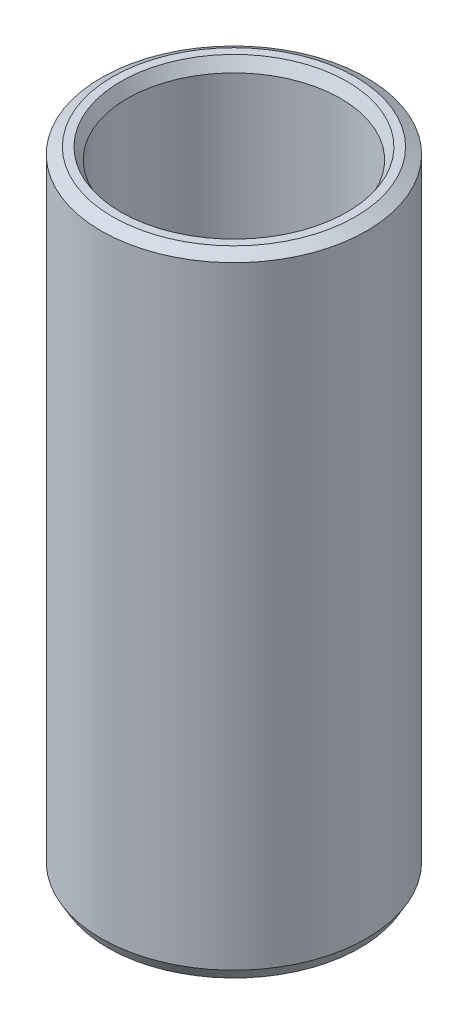
from build123d import *
from OCP.BRepFilletAPI import BRepFilletAPI_MakeChamfer

# Parameters (mm, degrees)
SKETCH1_R           = 55
BOSS_EXTRUDE1_DEPTH = 261.363555672
SKETCH2_R           = 44.170020311
CUT_EXTRUDE1_DEPTH  = 273.69196584
CHAMFER1_SIZE       = 2.720593937
CHAMFER1_SIZE2      = 4.712206925


with BuildPart() as part:
    # Sketch1 → Boss-Extrude1 (new body)
    with BuildSketch(Plane(origin=(0, 0, 0), x_dir=(1, 0, 0), z_dir=(0, 1, 0))):
        Circle(SKETCH1_R)
    extrude(amount=BOSS_EXTRUDE1_DEPTH)

    # Sketch2 → Cut-Extrude1 (cut, through all)
    with BuildSketch(Plane(origin=(0, 0, 0), x_dir=(1, 0, 0), z_dir=(0, 1, 0))):
        Circle(SKETCH2_R)
    extrude(amount=CUT_EXTRUDE1_DEPTH, mode=Mode.SUBTRACT)

    # Chamfer1: one chamfer whose edges measure the first distance from different faces: ONE call of the kernel's chamfer builder (chamfer() names one face for all edges)
    chamfer1_edges_1 = [part.edges().sort_by_distance(p)[0] for p in [
        (-44.170020311, 261.363555672, 0),
    ]]
    chamfer1_side_1 = [part.faces().sort_by_distance(p)[0] for p in [
        (-53.444365081, 261.363555672, 0),
    ]]
    chamfer1_edges_2 = [part.edges().sort_by_distance(p)[0] for p in [
        (-44.170020311, 0, 0),
    ]]
    chamfer1_side_2 = [part.faces().sort_by_distance(p)[0] for p in [
        (-44.170020311, 130.681777836, 0),
    ]]
    chamfer1_edges_3 = [part.edges().sort_by_distance(p)[0] for p in [
        (-55, 0, 0),
    ]]
    chamfer1_side_3 = [part.faces().sort_by_distance(p)[0] for p in [
        (-53.444365081, 0, 0),
    ]]
    chamfer1_edges_4 = [part.edges().sort_by_distance(p)[0] for p in [
        (-55, 261.363555672, 0),
    ]]
    chamfer1_side_4 = [part.faces().sort_by_distance(p)[0] for p in [
        (-55, 130.681777836, 0),
    ]]
    chamfer1 = BRepFilletAPI_MakeChamfer(part.part.solid().wrapped)
    for e in chamfer1_edges_1:
        chamfer1.Add(CHAMFER1_SIZE, CHAMFER1_SIZE2, e.wrapped, chamfer1_side_1[0].wrapped)  # the first distance lies on this face
    for e in chamfer1_edges_2:
        chamfer1.Add(CHAMFER1_SIZE, CHAMFER1_SIZE2, e.wrapped, chamfer1_side_2[0].wrapped)  # the first distance lies on this face
    for e in chamfer1_edges_3:
        chamfer1.Add(CHAMFER1_SIZE, CHAMFER1_SIZE2, e.wrapped, chamfer1_side_3[0].wrapped)  # the first distance lies on this face
    for e in chamfer1_edges_4:
        chamfer1.Add(CHAMFER1_SIZE, CHAMFER1_SIZE2, e.wrapped, chamfer1_side_4[0].wrapped)  # the first distance lies on this face
    add(Compound.cast(chamfer1.Shape()), mode=Mode.REPLACE)


solid = part.part
